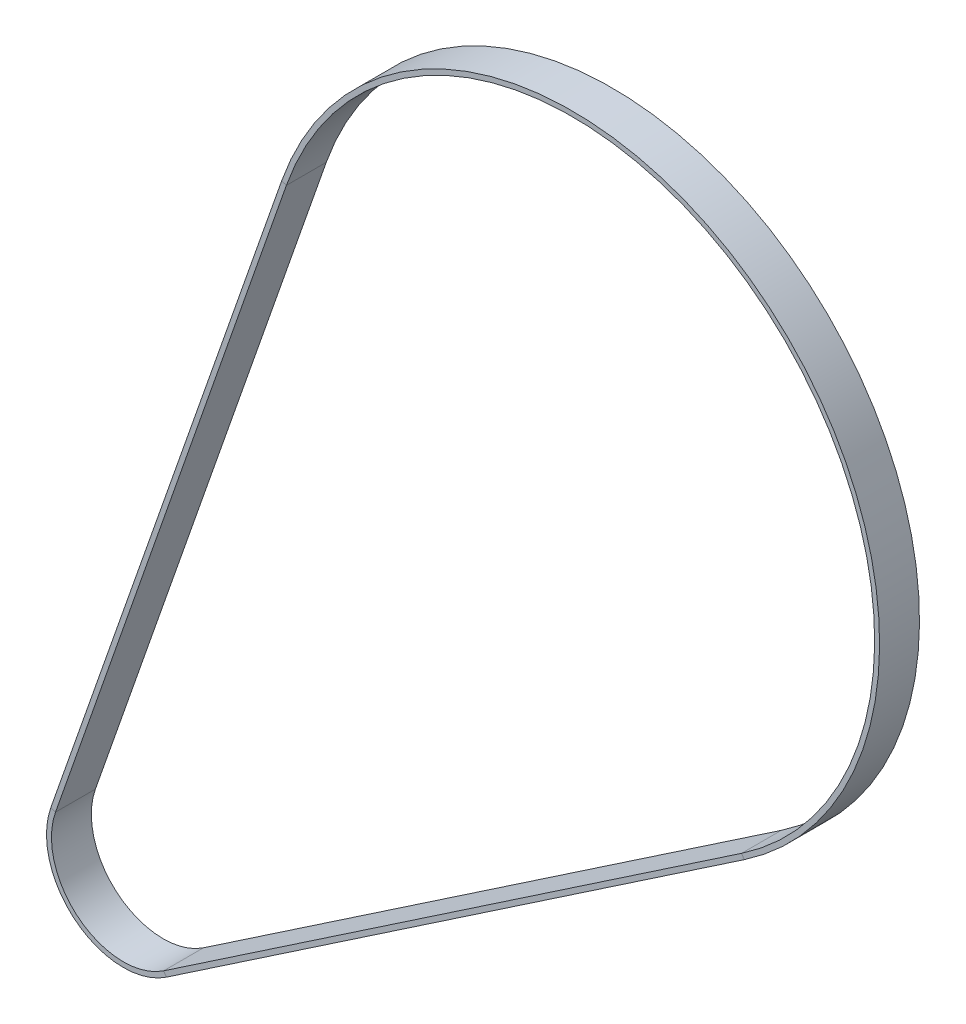
from build123d import *

# Parameters (mm, degrees)
SKETCH3_W = 0.5
SKETCH3_H = 4.023685774


with BuildPart() as part:
    # Sweep1: sweep along a path in Sketch2
    with BuildLine(Plane.XY) as sweep1_path:
        Line((17.248457562, -25.513240356), (-41.061386137, -64.934139089))
        ThreePointArc((-41.061386137, -64.934139089), (-49.855173637, -64.659892632), (-52.356779208, -56.224972403))
        Line((-52.356779208, -56.224972403), (-29.060923766, 10.19300896))
        ThreePointArc((-29.060923766, 10.19300896), (18.804724128, 24.388871895), (17.248457562, -25.513240356))
    # Sketch3 → Sweep1 (sweep)
    with BuildSketch(Plane(origin=(-52.356779208, -56.224972403, 0), x_dir=(0.9436385894180152, -0.3309776617253475, 0), z_dir=(0.3309776617253475, 0.9436385894180152, 0))):
        with Locations((0.006833178, 0)):
            Rectangle(SKETCH3_W, SKETCH3_H)
    sweep(path=sweep1_path.line)


solid = part.part
